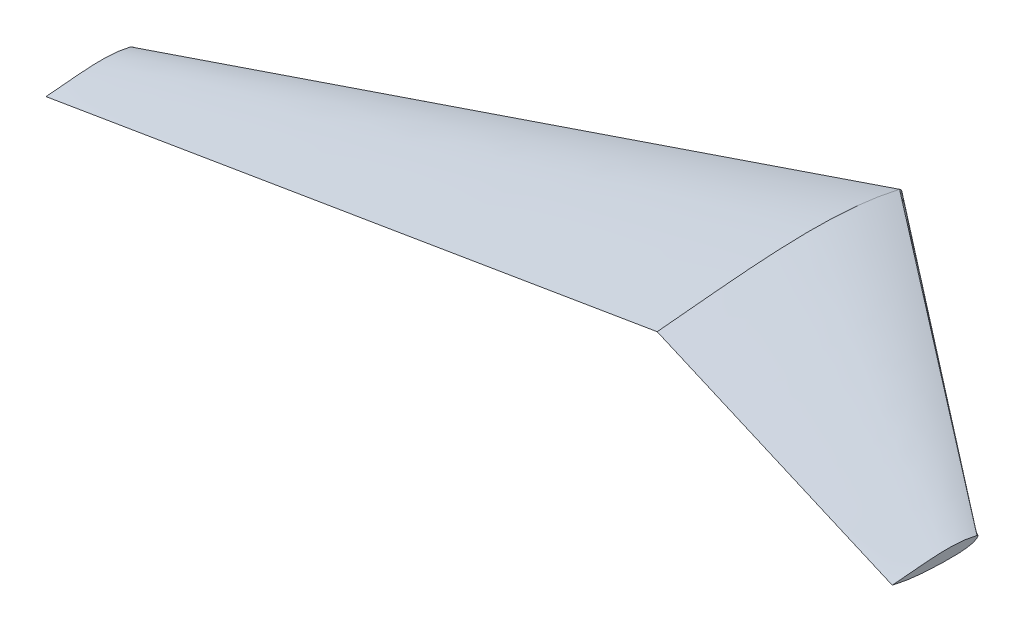
from build123d import *


with BuildPart() as part:
    # Loft1: read off the stored shape, not the designer's step
    # Loft1: loft between two sections, ruled curve by curve
    loft1_from = [
        Edge.make_bspline([(-7316.724, 1487.828669902, 35992.833537261), (-7316.724, 1421.530634915, 35723.092008862), (-7316.724, 1394.693159295, 35379.901383841), (-7316.724, 1387.988264311, 34974.190892011), (-7316.724, 1391.678508239, 34806.524518143), (-7316.724, 1407.205189879, 34673.46457986), (-7316.724, 1427.791236409, 34589.744448771), (-7316.724, 1454.952214092, 34536.114733088), (-7316.724, 1474.685690702, 34514.572417518), (-7316.724, 1487.828669902, 34510.931294061)], [0, 0, 0, 0, 0.549019603, 0.678988999, 0.804672907, 0.880861609, 0.944605534, 0.973770911, 1, 1, 1, 1], 3),
        Edge.make_bspline([(-7316.724, 1487.828669902, 34510.931294061), (-7316.724, 1492.676465868, 34513.556909875), (-7316.724, 1497.259788361, 34518.149007123), (-7316.724, 1500.076260171, 34525.355315708), (-7316.724, 1500.687080871, 34528.065394871), (-7316.724, 1500.885972938, 34529.287878902)], [0, 0, 0, 0, 0.658432941, 0.851821004, 1, 1, 1, 1], 3),
        Edge.make_bspline([(-7316.724, 1500.885972938, 34529.287878902), (-7316.724, 1564.423875614, 34785.858813384), (-7316.724, 1565.662563216, 35049.655510234), (-7316.724, 1541.104472042, 35402.846537303), (-7316.724, 1525.475445482, 35566.053445124), (-7316.724, 1510.037552147, 35767.7365592), (-7316.724, 1497.553701256, 35903.068198652), (-7316.724, 1492.849785991, 35968.110483148), (-7316.724, 1487.828669902, 35992.833537261)], [0, 0, 0, 0, 0.532234353, 0.535773715, 0.72250352, 0.866976858, 0.948633151, 1, 1, 1, 1], 3),
    ]
    loft1_to = [
        Edge.make_bspline([(0, 0, 32741.10546), (0, -142.662359591, 32169.005568548), (0, -232.168298131, 31444.699397963), (0, -271.214486884, 30581.102822245), (0, -279.128640205, 30224.862671342), (0, -281.644558088, 29940.08999998), (0, -281.923932184, 29759.077669805), (0, -281.64422132, 29631.721986491), (0, -281.400074941, 29572.561654823), (0, -281.262525316, 29544.562900783)], [0, 0, 0, 0, 0.549019603, 0.678988999, 0.804672907, 0.880861609, 0.944605534, 0.973770911, 1, 1, 1, 1], 3),
        Edge.make_bspline([(0, -281.262525316, 29544.562900783), (0, -272.428974899, 29299.640365417), (0, -250.673172157, 28941.253380059), (0, -121.087947726, 28603.106420122), (0, -13.059719976, 28470.904486664), (0, 37.355151767, 28550.622394943)], [0, 0, 0, 0, 0.658432941, 0.851821004, 1, 1, 1, 1], 3),
        Edge.make_bspline([(0, 37.355151767, 28550.622394943), (0, 206.735400994, 29283.341411522), (0, 211.500505822, 30039.335823411), (0, 153.657670514, 31051.923075175), (0, 116.397175309, 31519.943049771), (0, 60.787691696, 32096.192651089), (0, 23.527460083, 32483.558150881), (0, 6.423676977, 32669.343106672), (0, 0, 32741.10546)], [0, 0, 0, 0, 0.532234353, 0.535773715, 0.72250352, 0.866976858, 0.948633151, 1, 1, 1, 1], 3),
    ]
    loft1 = Solid(Shell([*[Face.make_surface_from_curves(loft1_from[k], loft1_to[k]) for k in range(3)], Face(Wire(loft1_from)), Face(Wire(loft1_to))]))
    add(loft1)

    # Mirror1: part across plane


with BuildPart() as part_1:
    add(part.part)
    add(part.part.mirror(Plane(origin=(0, 0, 0), x_dir=(0, 0, 1), z_dir=(1, 0, 0))))


solid = part_1.part
